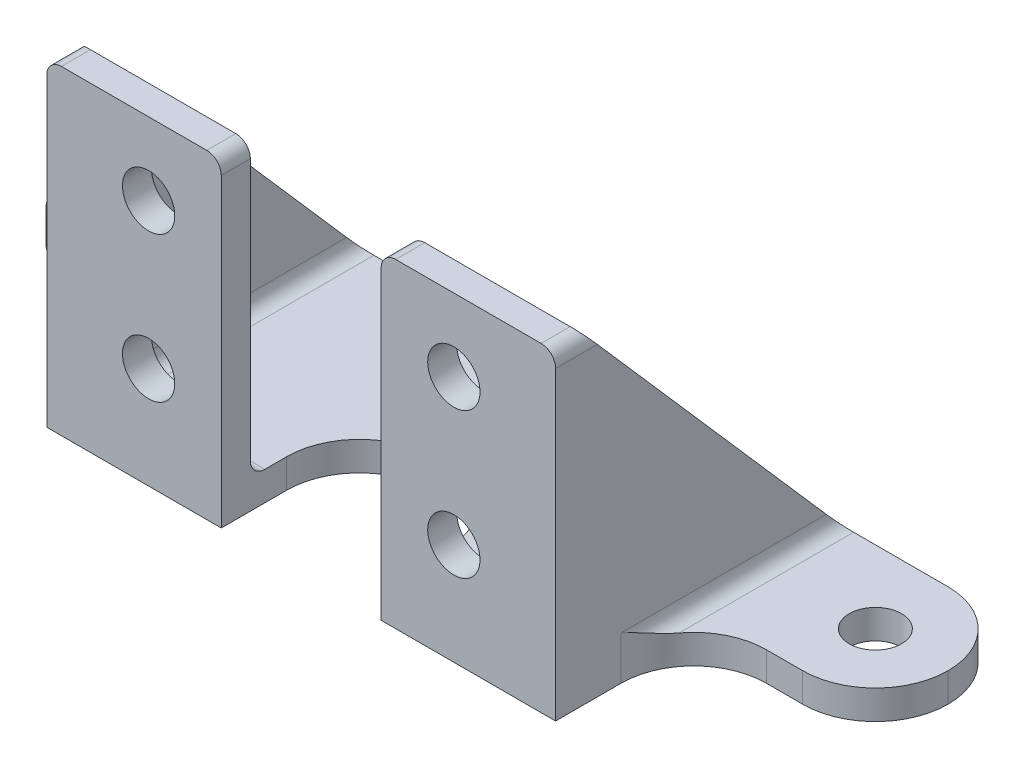
from build123d import *

# Parameters (mm, degrees)
SKETCH1_R           = 1.8
BOSS_EXTRUDE1_DEPTH = 2
SKETCH2_W           = 12
SKETCH2_H           = 2
BOSS_EXTRUDE2_DEPTH = 20
SKETCH3_R           = 1.8
CUT_EXTRUDE1_DEPTH  = 56.195108479
BOSS_EXTRUDE3_DEPTH = 2
BOSS_EXTRUDE4_DEPTH = 2
FILLET1_R           = 5
FILLET2_R           = 5
FILLET3_R           = 1
FILLET4_R           = 1


with BuildPart() as part:
    # Sketch1 → Boss-Extrude1 (new body)
    with BuildSketch(Plane(origin=(0, 0, 0), x_dir=(1, 0, 0), z_dir=(0, 1, 0))):
        Polygon((-12.5, 19.5), (47.5, 19.5), (47.5, 9.5), (35, 9.5), (35, 0), (23, 0), (23, 9.5), (12, 9.5), (12, 0), (0, 0), (0, 9.5), (-12.5, 9.5), align=None)
        with Locations(Location((-7.5, 14.5, 0), (0, 0, 270))):
            Circle(SKETCH1_R, mode=Mode.SUBTRACT)
        with Locations(Location((42.5, 14.5, 0), (0, 0, 270))):
            Circle(SKETCH1_R, mode=Mode.SUBTRACT)
    extrude(amount=BOSS_EXTRUDE1_DEPTH)

    # Sketch2 → Boss-Extrude2 (add)
    with BuildSketch(Plane(origin=(0, 2, 0), x_dir=(1, 0, 0), z_dir=(0, 1, 0))):
        with Locations((29, 1)):
            Rectangle(SKETCH2_W, SKETCH2_H)
        with Locations((6, 1)):
            Rectangle(SKETCH2_W, SKETCH2_H)
    extrude(amount=BOSS_EXTRUDE2_DEPTH)

    # Sketch3 → Cut-Extrude1 (cut, through all)
    with BuildSketch(Plane(origin=(0, 0, -2), x_dir=(-1, 0, 0), z_dir=(0, 0, -1))):
        with Locations((-7, 7)):
            Circle(SKETCH3_R)
        with Locations((-7, 17)):
            Circle(SKETCH3_R)
        with Locations((-28, 7)):
            Circle(SKETCH3_R)
        with Locations((-28, 17)):
            Circle(SKETCH3_R)
    extrude(amount=-CUT_EXTRUDE1_DEPTH, mode=Mode.SUBTRACT)

    # Sketch4 → Boss-Extrude3 (add)
    with BuildSketch(Plane.ZY):
        Polygon((-2, 22), (-2, 2), (-19.5, 2), align=None)
    extrude(amount=-BOSS_EXTRUDE3_DEPTH)

    # Sketch5 → Boss-Extrude4 (add)
    with BuildSketch(Plane(origin=(35, 0, 0), x_dir=(0, 0, -1), z_dir=(1, 0, 0))):
        Polygon((2, 22), (2, 2), (19.5, 2), align=None)
    extrude(amount=-BOSS_EXTRUDE4_DEPTH)

    # Fillet1
    fillet1_edges = [part.edges().sort_by_distance(p)[0] for p in [
        (35, 1, -9.5),
        (23, 1, -9.5),
        (12, 1, -9.5),
        (0, 1, -9.5),
    ]]
    fillet(fillet1_edges, radius=FILLET1_R)

    # Fillet2
    fillet2_edges = [part.edges().sort_by_distance(p)[0] for p in [
        (47.5, 1, -9.5),
        (47.5, 1, -19.5),
        (-12.5, 1, -19.5),
        (-12.5, 1, -9.5),
    ]]
    fillet(fillet2_edges, radius=FILLET2_R - 0.0001)  # a hair under: the kernel refuses the full size

    # Fillet3
    fillet3_edges = [part.edges().sort_by_distance(p)[0] for p in [
        (33, 2, -10.75),
        (33, 12, -2),
        (35, 2, -12),
        (7, 2, -2),
        (2, 12, -2),
        (2, 2, -10.75),
        (0, 2, -12),
        (28, 2, -2),
    ]]
    fillet(fillet3_edges, radius=FILLET3_R)

    # Fillet4
    fillet4_edges = [part.edges().sort_by_distance(p)[0] for p in [
        (0, 22, -1),
        (12, 22, -1),
        (23, 22, -1),
        (35, 22, -1),
    ]]
    fillet(fillet4_edges, radius=FILLET4_R)


solid = part.part
